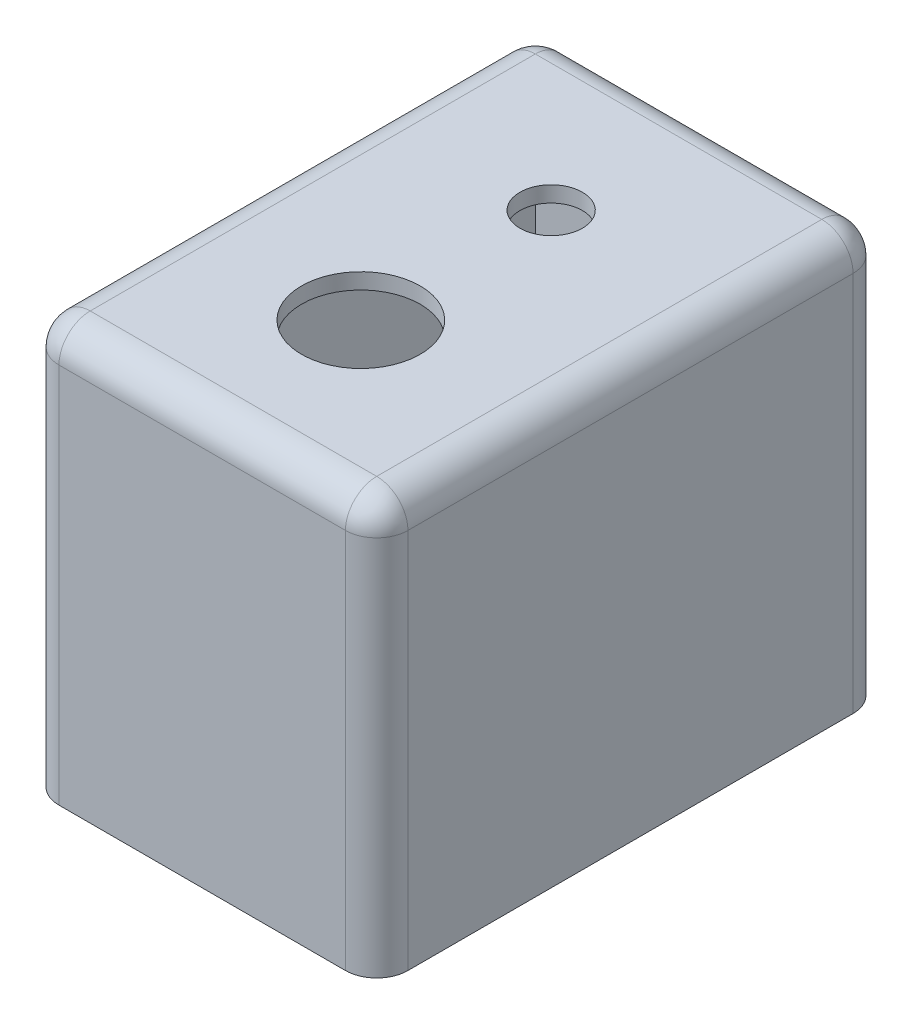
from build123d import *

# Parameters (mm, degrees)
SKETCH2_W                = 55.88
SKETCH2_H                = 81.28
SKETCH2_W_2              = 50.8
SKETCH2_H_2              = 76.2
BOSS_EXTRUDE1_DEPTH      = 63.5
BOSS_EXTRUDE2_DEPTH      = 27.94
BOSS_EXTRUDE2_DEPTH_BACK = 27.94
SKETCH3_W                = 81.28
SKETCH3_H                = 2.54
FILLET1_R                = 5
FILLET4_R                = 5
FILLET5_R                = 5
FILLET6_R                = 5
FILLET7_R                = 5
CUT_EXTRUDE1_REACH       = 84.423
SKETCH4_R                = 5
SKETCH4_R_2              = 9.5
CUT_EXTRUDE2_REACH       = 110.39
SKETCH6_R                = 10


with BuildPart() as part:
    # Sketch2 → Boss-Extrude1 (new body)
    with BuildSketch(Plane(origin=(0, 0, 0), x_dir=(1, 0, 0), z_dir=(0, 1, 0))):
        Rectangle(SKETCH2_W, SKETCH2_H)
        Rectangle(SKETCH2_W_2, SKETCH2_H_2, mode=Mode.SUBTRACT)
    extrude(amount=BOSS_EXTRUDE1_DEPTH)

    # Sketch3 → Boss-Extrude2 (add, two sides: drawn at the far end of the back side and taken through both)
    with BuildSketch(Plane(origin=(0, 0, 0), x_dir=(0, 0, -1), z_dir=(1, 0, 0)).offset(-BOSS_EXTRUDE2_DEPTH_BACK)):
        with Locations((0, 64.77)):
            Rectangle(SKETCH3_W, SKETCH3_H)
    extrude(amount=BOSS_EXTRUDE2_DEPTH + BOSS_EXTRUDE2_DEPTH_BACK)

    # Fillet1
    fillet1_edges = [part.edges().sort_by_distance(p)[0] for p in [
        (0, 66.04, 40.64),
        (0, 66.04, -40.64),
        (-27.94, 66.04, 0),
        (27.94, 66.04, 0),
    ]]
    fillet(fillet1_edges, radius=FILLET1_R)

    # Fillet4
    # the kernel refuses this fillet: 5 mm, written as the material it takes off along each edge
    with BuildSketch(Plane(origin=(-22.94, 61.04, -35.64), x_dir=(-1, 0, 0), z_dir=(0, 0, -1))) as fillet4_piece_1_section:
        Polygon((0, 0), (FILLET4_R, 0), (FILLET4_R, FILLET4_R), (0, FILLET4_R), align=None)
    fillet4_piece_1 = extrude(amount=FILLET4_R, mode=Mode.PRIVATE)
    fillet4_piece_1 = fillet4_piece_1 - Plane(origin=(-22.94, 61.04, -35.64), x_dir=(0.7071067811865475, -0.7071067811865475, 0), z_dir=(0, 0, -1)) * Sphere(FILLET4_R, mode=Mode.PRIVATE)
    add(fillet4_piece_1, mode=Mode.SUBTRACT)
    with BuildSketch(Plane(origin=(-27.94, -12.5, -40.64), x_dir=(1, 0, 0), z_dir=(0, 1, 0))) as fillet4_piece_2:
        with BuildLine():
            CenterArc((FILLET4_R, -FILLET4_R), FILLET4_R, 90, 90)
            Line((0, -FILLET4_R), (0, 0))
            Line((0, 0), (FILLET4_R, 0))
        make_face()
    extrude(amount=73.54, mode=Mode.SUBTRACT)

    # Fillet5
    # the kernel refuses this fillet: 5 mm, written as the material it takes off along each edge
    with BuildSketch(Plane(origin=(22.94, 61.04, -35.64), x_dir=(1, 0, 0), z_dir=(0, 0, -1))) as fillet5_piece_1_section:
        Polygon((0, 0), (FILLET5_R, 0), (FILLET5_R, -FILLET5_R), (0, -FILLET5_R), align=None)
    fillet5_piece_1 = extrude(amount=FILLET5_R, mode=Mode.PRIVATE)
    fillet5_piece_1 = fillet5_piece_1 - Plane(origin=(22.94, 61.04, -35.64), x_dir=(-0.7071067811865475, -0.7071067811865475, 0), z_dir=(0, 0, -1)) * Sphere(FILLET5_R, mode=Mode.PRIVATE)
    add(fillet5_piece_1, mode=Mode.SUBTRACT)
    with BuildSketch(Plane(origin=(27.94, 61.04, -40.64), x_dir=(-1, 0, 0), z_dir=(0, -1, 0))) as fillet5_piece_2:
        with BuildLine():
            CenterArc((FILLET5_R, -FILLET5_R), FILLET5_R, 90, 90)
            Line((0, -FILLET5_R), (0, 0))
            Line((0, 0), (FILLET5_R, 0))
        make_face()
    extrude(amount=73.54, mode=Mode.SUBTRACT)

    # Fillet6
    # the kernel refuses this fillet: 5 mm, written as the material it takes off along each edge
    with BuildSketch(Plane(origin=(22.94, 61.04, 35.64), x_dir=(1, 0, 0), z_dir=(0, 0, 1))) as fillet6_piece_1_section:
        Polygon((0, 0), (FILLET6_R, 0), (FILLET6_R, FILLET6_R), (0, FILLET6_R), align=None)
    fillet6_piece_1 = extrude(amount=FILLET6_R, mode=Mode.PRIVATE)
    fillet6_piece_1 = fillet6_piece_1 - Plane(origin=(22.94, 61.04, 35.64), x_dir=(-0.7071067811865475, -0.7071067811865475, 0), z_dir=(0, 0, 1)) * Sphere(FILLET6_R, mode=Mode.PRIVATE)
    add(fillet6_piece_1, mode=Mode.SUBTRACT)
    with BuildSketch(Plane(origin=(27.94, 61.04, 40.64), x_dir=(-1, 0, 0), z_dir=(0, -1, 0))) as fillet6_piece_2:
        with BuildLine():
            CenterArc((FILLET6_R, FILLET6_R), FILLET6_R, 180, 90)
            Line((0, FILLET6_R), (0, 0))
            Line((0, 0), (FILLET6_R, 0))
        make_face()
    extrude(amount=73.54, mode=Mode.SUBTRACT)

    # Fillet7
    # the kernel refuses this fillet: 5 mm, written as the material it takes off along each edge
    with BuildSketch(Plane(origin=(-22.94, 61.04, 35.64), x_dir=(-1, 0, 0), z_dir=(0, 0, 1))) as fillet7_piece_1_section:
        Polygon((0, 0), (FILLET7_R, 0), (FILLET7_R, -FILLET7_R), (0, -FILLET7_R), align=None)
    fillet7_piece_1 = extrude(amount=FILLET7_R, mode=Mode.PRIVATE)
    fillet7_piece_1 = fillet7_piece_1 - Plane(origin=(-22.94, 61.04, 35.64), x_dir=(0.7071067811865475, -0.7071067811865475, 0), z_dir=(0, 0, 1)) * Sphere(FILLET7_R, mode=Mode.PRIVATE)
    add(fillet7_piece_1, mode=Mode.SUBTRACT)
    with BuildSketch(Plane(origin=(-27.94, -12.5, 40.64), x_dir=(1, 0, 0), z_dir=(0, 1, 0))) as fillet7_piece_2:
        with BuildLine():
            CenterArc((FILLET7_R, FILLET7_R), FILLET7_R, 180, 90)
            Line((0, FILLET7_R), (0, 0))
            Line((0, 0), (FILLET7_R, 0))
        make_face()
    extrude(amount=73.54, mode=Mode.SUBTRACT)

    # Sketch4 → Cut-Extrude1 (cut, up to next)
    with BuildSketch(Plane(origin=(0, 0, 0), x_dir=(1, 0, 0), z_dir=(0, 1, 0)), mode=Mode.PRIVATE) as cut_extrude1_sk1:
        with Locations(Location((0, 15.24, 0), (0, 0, 90))):
            Circle(SKETCH4_R)
    cut_extrude1_tool1 = extrude(cut_extrude1_sk1.sketch, amount=CUT_EXTRUDE1_REACH, mode=Mode.PRIVATE) & part.part
    # Sketch4 → Cut-Extrude1 (cut, up to next)
    with BuildSketch(Plane(origin=(0, 0, 0), x_dir=(1, 0, 0), z_dir=(0, 1, 0)), mode=Mode.PRIVATE) as cut_extrude1_sk2:
        with Locations(Location((0, -15.24, 0), (0, 0, 90))):
            Circle(SKETCH4_R_2)
    cut_extrude1_tool2 = extrude(cut_extrude1_sk2.sketch, amount=CUT_EXTRUDE1_REACH, mode=Mode.PRIVATE) & part.part
    add(cut_extrude1_tool1.solids().sort_by_distance((0, 0, -15.24))[0], mode=Mode.SUBTRACT)
    add(cut_extrude1_tool2.solids().sort_by_distance((0, 0, 15.24))[0], mode=Mode.SUBTRACT)

    # Sketch6 → Cut-Extrude2 (cut, up to next)
    with BuildSketch(Plane(origin=(0, 0, -40.64), x_dir=(-1, 0, 0), z_dir=(0, 0, -1)), mode=Mode.PRIVATE) as cut_extrude2_sk1:
        Circle(SKETCH6_R)
    cut_extrude2_tool1 = extrude(cut_extrude2_sk1.sketch, amount=-CUT_EXTRUDE2_REACH, mode=Mode.PRIVATE) & part.part
    add(cut_extrude2_tool1.solids().sort_by_distance((0, 0, -40.64))[0], mode=Mode.SUBTRACT)


solid = part.part
